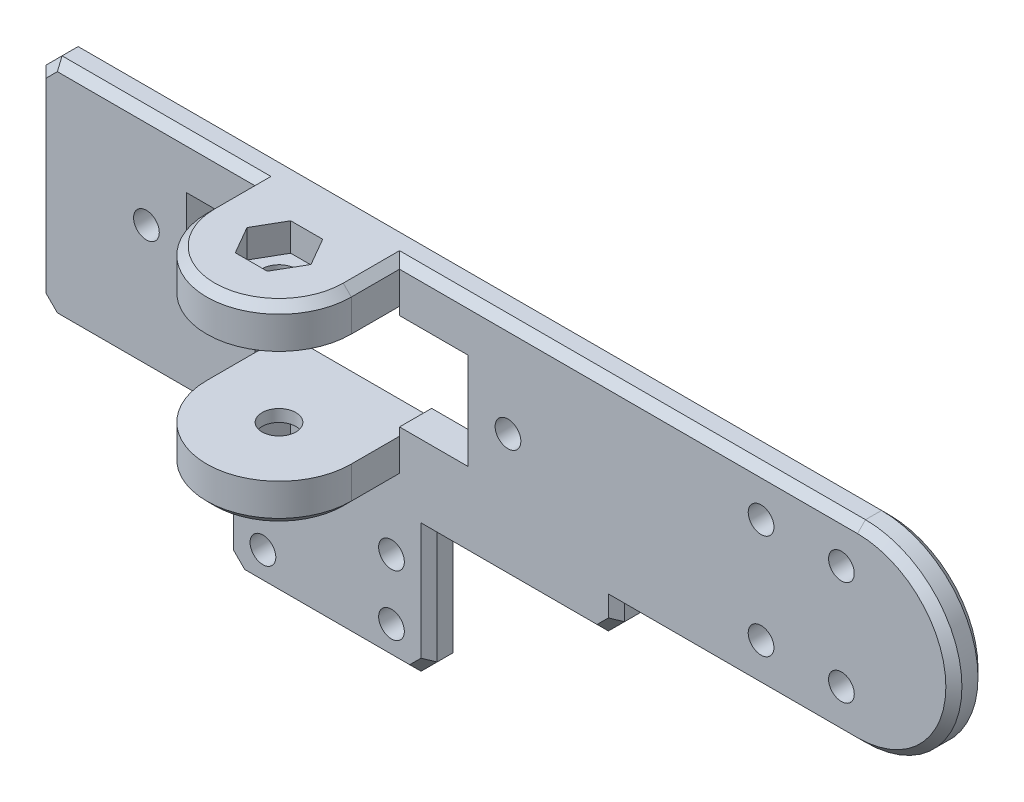
from build123d import *

# Parameters (mm, degrees)
CROQUIS1_W              = 72
CROQUIS1_H              = 24
CROQUIS1_R              = 1.6
CROQUIS1_W_2            = 35
CROQUIS1_H_2            = 12
SALIENTE_EXTRUIR1_DEPTH = 4
CROQUIS2_R              = 3.125
SALIENTE_EXTRUIR2_DEPTH = 4
CROQUIS3_R              = 1.6
SALIENTE_EXTRUIR3_DEPTH = 4
CROQUIS5_R              = 2.1
SALIENTE_EXTRUIR4_DEPTH = 5
CORTAR_EXTRUIR1_DEPTH   = 3.5
REDONDEO1_R             = 3
CROQUIS7_W              = 25.361567636
CROQUIS7_H              = 16
CROQUIS7_R              = 1.6
SALIENTE_EXTRUIR5_DEPTH = 4
CHAFL_N1_SIZE           = 2
CHAFL_N2_SIZE           = 1
CROQUIS8_W              = 18
CROQUIS8_H              = 14
CORTAR_EXTRUIR2_DEPTH   = 87.423376467
CROQUIS9_W              = 19.069204895
CROQUIS9_H              = 8.04839492
CORTAR_EXTRUIR3_DEPTH   = 120.920807202


with BuildPart() as part:
    # Croquis1 → Saliente-Extruir1 (new body)
    with BuildSketch(Plane.XY):
        Rectangle(CROQUIS1_W, CROQUIS1_H)
        with Locations((-22.5, 0)):
            Circle(CROQUIS1_R, mode=Mode.SUBTRACT)
        with Locations(Location((22.5, 0, 0), (0, 0, 180))):
            Circle(CROQUIS1_R, mode=Mode.SUBTRACT)
        Rectangle(CROQUIS1_W_2, CROQUIS1_H_2, mode=Mode.SUBTRACT)
    extrude(amount=SALIENTE_EXTRUIR1_DEPTH)

    # Croquis2 → Saliente-Extruir2 (add)
    with BuildSketch(Plane.XZ.offset(12)):
        with BuildLine():
            Line((-5, -10), (-5, -4))
            Line((-5, -4), (-36, -4))
            Line((-36, -4), (-36, 4))
            Line((-36, 4), (36, 4))
            Line((36, 4), (36, -4))
            Line((36, -4), (5, -4))
            Line((5, -4), (5, -10))
            ThreePointArc((5, -10), (0, -15), (-5, -10))
        make_face()
        with Locations((0, -10)):
            Circle(CROQUIS2_R, mode=Mode.SUBTRACT)
    extrude(amount=SALIENTE_EXTRUIR2_DEPTH)

    # Croquis3 → Saliente-Extruir3 (add)
    with BuildSketch(Plane(origin=(0, 0, 0), x_dir=(-1, 0, 0), z_dir=(0, 0, -1))):
        with BuildLine():
            Line((-66, 12), (-36, 12))
            Line((-36, 12), (-36, -12))
            Line((-36, -12), (-66, -12))
            ThreePointArc((-66, -12), (-78, 0), (-66, 12))
        make_face()
        with Locations((-54, 6.5)):
            Circle(CROQUIS3_R, mode=Mode.SUBTRACT)
        with Locations((-64, 6.5)):
            Circle(CROQUIS3_R, mode=Mode.SUBTRACT)
        with Locations(Location((-54, -6.5, 0), (0, 0, 180))):
            Circle(CROQUIS3_R, mode=Mode.SUBTRACT)
        with Locations(Location((-64, -6.5, 0), (0, 0, 180))):
            Circle(CROQUIS3_R, mode=Mode.SUBTRACT)
    extrude(amount=-SALIENTE_EXTRUIR3_DEPTH)

    # Croquis5 → Saliente-Extruir4 (add)
    with BuildSketch(Plane(origin=(0, 12, 0), x_dir=(1, 0, 0), z_dir=(0, 1, 0))):
        with BuildLine():
            Line((-9, -10), (-9, -4))
            Line((-9, -4), (9, -4))
            Line((9, -4), (9, -10))
            ThreePointArc((9, -10), (0, -19), (-9, -10))
        make_face()
        with Locations(Location((0, -10, 0), (0, 0, 180))):
            Circle(CROQUIS5_R, mode=Mode.SUBTRACT)
    saliente_extruir4 = extrude(amount=-SALIENTE_EXTRUIR4_DEPTH)

    # Croquis6 → Cortar-Extruir1 (cut)
    with BuildSketch(Plane(origin=(0, 12, 0), x_dir=(1, 0, 0), z_dir=(0, 1, 0))):
        Polygon((3.982338332, -10), (1.991169166, -6.551193838), (-1.991169166, -6.551193838), (-3.982338332, -10), (-1.991169166, -13.448806162), (1.991169166, -13.448806162), align=None)
    cortar_extruir1 = extrude(amount=-CORTAR_EXTRUIR1_DEPTH, mode=Mode.SUBTRACT)

    # Simetría1: Saliente-Extruir4, Cortar-Extruir1 across plane
    add(saliente_extruir4.mirror(Plane.ZX))
    add(cortar_extruir1.mirror(Plane.ZX), mode=Mode.SUBTRACT)

    # Redondeo1
    redondeo1_edges = [part.edges().sort_by_distance(p)[0] for p in [
        (0, -12, 0),
    ]]
    fillet(redondeo1_edges, radius=REDONDEO1_R)

    # Croquis7 → Saliente-Extruir5 (add)
    with BuildSketch(Plane.XY.offset(4)):
        with Locations((0, -24)):
            Rectangle(CROQUIS7_W, CROQUIS7_H)
        with Locations((-8, -20.25)):
            Circle(CROQUIS7_R, mode=Mode.SUBTRACT)
        with Locations(Location((8, -20.25, 0), (0, 0, 180))):
            Circle(CROQUIS7_R, mode=Mode.SUBTRACT)
        with Locations((8, -27.75)):
            Circle(CROQUIS7_R, mode=Mode.SUBTRACT)
        with Locations(Location((-8, -27.75, 0), (0, 0, 180))):
            Circle(CROQUIS7_R, mode=Mode.SUBTRACT)
    extrude(amount=-SALIENTE_EXTRUIR5_DEPTH)

    # Chaflán1
    chafl_n1_edges = [part.edges().sort_by_distance(p)[0] for p in [
        (12.680783818, -32, 2),
        (-12.680783818, -32, 2),
        (36, -16, 0),
        (-36, -16, 0),
        (-36, 12, 2),
    ]]
    chamfer(chafl_n1_edges, length=CHAFL_N1_SIZE)

    # Chaflán2
    # the kernel refuses this chamfer: 1 mm, written as the material it takes off along each edge
    with BuildSketch(Plane(origin=(0, -12, 10), x_dir=(1, 0, 0), z_dir=(0, 0, -1))) as chafl_n2_piece_1:
        Polygon((9 - CHAFL_N2_SIZE, 0), (9, -CHAFL_N2_SIZE), (9, 0), align=None)
    revolve(axis=Axis((0, -12, 10), (0, -1, 0)), revolution_arc=180, mode=Mode.SUBTRACT)
    with BuildSketch(Plane(origin=(9, -12, 4), x_dir=(-0.9996219169112968, -0.027495876610585623, 0), z_dir=(0, 0, 1)), Plane(origin=(-9, -12, 10), x_dir=(0.9996219169112968, -0.0274958766105856, 0), z_dir=(0, 0, -1))) as chafl_n2_piece_2:
        Polygon((CHAFL_N2_SIZE * 0.999621916911, -CHAFL_N2_SIZE * 0.0274958766106), (-CHAFL_N2_SIZE * 0.0274958766106, -CHAFL_N2_SIZE * 0.999621916911), (0, 0), align=None)
    extrude(amount=6, mode=Mode.SUBTRACT)
    with BuildSketch(Plane(origin=(-36.571682988, -16, 4), x_dir=(0, 0.9996219169112968, 0.02749587661058651), z_dir=(1, 0, 0)), Plane(origin=(12.680783818, -16, 4), x_dir=(0, 0.9996219169112968, 0.02749587661058651), z_dir=(1, 0, 0))) as chafl_n2_piece_3:
        Polygon((CHAFL_N2_SIZE * 0.999621916911, -CHAFL_N2_SIZE * 0.0274958766106), (-CHAFL_N2_SIZE * 0.0274958766106, -CHAFL_N2_SIZE * 0.999621916911), (0, 0), align=None)
    extrude(amount=23.89089917, mode=Mode.SUBTRACT)
    with BuildSketch(Plane(origin=(-12.680783818, -16, 0), x_dir=(-0.02749587661058563, 0, 0.9996219169112968), z_dir=(0, -1, 0)), Plane(origin=(-12.680783818, -16, 4), x_dir=(0.9996219169112968, 0, 0.02749587661058651), z_dir=(0, -1, 0)), Plane(origin=(12.680783818, -32.571682988, 4), x_dir=(-0.9996219169112968, 0, 0.02749587661058651), z_dir=(0, 1, 0)), Plane(origin=(12.680783818, -32.571682988, 0), x_dir=(0.02749587661058563, 0, 0.9996219169112968), z_dir=(0, 1, 0))) as chafl_n2_piece_4:
        Polygon((CHAFL_N2_SIZE * 0.999621916911, -CHAFL_N2_SIZE * 0.0274958766106), (-CHAFL_N2_SIZE * 0.0274958766106, -CHAFL_N2_SIZE * 0.999621916911), (0, 0), align=None)
    extrude(amount=16.571682988, mode=Mode.SUBTRACT)
    with BuildSketch(Plane(origin=(-36, 12.571682988, 4), x_dir=(0.9996219169112968, 0, 0.027495876610586414), z_dir=(0, -1, 0))) as chafl_n2_piece_5:
        Polygon((CHAFL_N2_SIZE * 0.999621916911, -CHAFL_N2_SIZE * 0.0274958766106), (-CHAFL_N2_SIZE * 0.0274958766106, -CHAFL_N2_SIZE * 0.999621916911), (0, 0), align=None)
    extrude(amount=29.143365976, mode=Mode.SUBTRACT)
    with BuildSketch(Plane(origin=(-13.252466806, -32, 4), x_dir=(0, 0.9996219169112968, 0.02749587661058651), z_dir=(1, 0, 0)), Plane(origin=(-13.252466806, -32, 0), x_dir=(0, -0.02749587661058908, 0.9996219169112968), z_dir=(1, 0, 0))) as chafl_n2_piece_6:
        Polygon((CHAFL_N2_SIZE * 0.999621916911, -CHAFL_N2_SIZE * 0.0274958766106), (-CHAFL_N2_SIZE * 0.0274958766106, -CHAFL_N2_SIZE * 0.999621916911), (0, 0), align=None)
    extrude(amount=26.504933612, mode=Mode.SUBTRACT)
    with BuildSketch(Plane(origin=(36, -12, 4), x_dir=(0.02749587661058907, 0, -0.9996219169112965), z_dir=(0, -1, 0))) as chafl_n2_piece_7:
        Polygon((CHAFL_N2_SIZE * 0.999621916911, -CHAFL_N2_SIZE * 0.0274958766106), (-CHAFL_N2_SIZE * 0.0274958766106, -CHAFL_N2_SIZE * 0.999621916911), (0, 0), align=None)
    extrude(amount=4.571682988, mode=Mode.SUBTRACT)
    with BuildSketch(Plane(origin=(14.499238298, -28.18154552, 4), x_dir=(-0.7068394360706736, 0.7068394360706736, 0.027495876610586528), z_dir=(-0.7071067811865476, -0.7071067811865476, 0)), Plane(origin=(-32.18154552, -17.81845448, 4), x_dir=(0.7068394360706736, 0.7068394360706736, 0.027495876610586563), z_dir=(-0.7071067811865476, 0.7071067811865476, 0)), Plane(origin=(-37.81845448, 8.18154552, 4), x_dir=(0.7068394360706736, -0.7068394360706736, 0.027495876610586462), z_dir=(0.7071067811865476, 0.7071067811865476, 0))) as chafl_n2_piece_8:
        Polygon((CHAFL_N2_SIZE * 0.999621916911, CHAFL_N2_SIZE * 0.0274958766106), (-CHAFL_N2_SIZE * 0.0274958766106, CHAFL_N2_SIZE * 0.999621916911), (0, 0), align=None)
    extrude(amount=7.971793101, mode=Mode.SUBTRACT)
    with BuildSketch(Plane(origin=(-14.499238298, -28.18154552, 4), x_dir=(0.7068394360706736, 0.7068394360706736, 0.027495876610586528), z_dir=(0.7071067811865476, -0.7071067811865476, 0)), Plane(origin=(37.81845448, -12.18154552, 4), x_dir=(0.019442520806013792, -0.019442520806013792, -0.9996219169112968), z_dir=(-0.7071067811865476, -0.7071067811865476, 0)), Plane(origin=(-14.499238298, -28.18154552, 0), x_dir=(-0.019442520806013792, -0.019442520806013792, 0.9996219169112968), z_dir=(0.7071067811865476, -0.7071067811865476, 0))) as chafl_n2_piece_9:
        Polygon((CHAFL_N2_SIZE * 0.999621916911, -CHAFL_N2_SIZE * 0.0274958766106), (-CHAFL_N2_SIZE * 0.0274958766106, -CHAFL_N2_SIZE * 0.999621916911), (0, 0), align=None)
    extrude(amount=7.971793101, mode=Mode.SUBTRACT)
    with BuildSketch(Plane(origin=(-36.571682988, 12, 0), x_dir=(0, -0.9996219169112968, -0.02749587661058639), z_dir=(1, 0, 0))) as chafl_n2_piece_10:
        Polygon((CHAFL_N2_SIZE * 0.999621916911, -CHAFL_N2_SIZE * 0.0274958766106), (-CHAFL_N2_SIZE * 0.0274958766106, -CHAFL_N2_SIZE * 0.999621916911), (0, 0), align=None)
    extrude(amount=102.571682988, mode=Mode.SUBTRACT)
    with BuildSketch(Plane(origin=(66, 0, 4), x_dir=(0, -1, 0), z_dir=(-1, 0, 0))) as chafl_n2_piece_11:
        Polygon((12 - CHAFL_N2_SIZE, 0), (12, -CHAFL_N2_SIZE), (12, 0), align=None)
    revolve(axis=Axis((66, 0, 4), (0, 0, 1)), revolution_arc=180, mode=Mode.SUBTRACT)
    with BuildSketch(Plane(origin=(66, 0, 0), x_dir=(0, -1, 0), z_dir=(-1, 0, 0))) as chafl_n2_piece_12:
        Polygon((12 - CHAFL_N2_SIZE, 0), (12, CHAFL_N2_SIZE), (12, 0), align=None)
    revolve(axis=Axis((66, 0, 0), (0, 0, 1)), revolution_arc=180, mode=Mode.SUBTRACT)
    with BuildSketch(Plane(origin=(36, -12, 0), x_dir=(0, -0.02749587661058563, 0.9996219169112968), z_dir=(1, 0, 0)), Plane(origin=(36, -12, 4), x_dir=(0, 0.9996219169112968, 0.02749587661058651), z_dir=(1, 0, 0))) as chafl_n2_piece_13:
        Polygon((CHAFL_N2_SIZE * 0.999621916911, -CHAFL_N2_SIZE * 0.0274958766106), (-CHAFL_N2_SIZE * 0.0274958766106, -CHAFL_N2_SIZE * 0.999621916911), (0, 0), align=None)
    extrude(amount=30, mode=Mode.SUBTRACT)
    with BuildSketch(Plane(origin=(-9, 12, 4), x_dir=(0, -0.9996219169112968, 0.02749587661058651), z_dir=(-1, 0, 0))) as chafl_n2_piece_14:
        Polygon((CHAFL_N2_SIZE * 0.999621916911, -CHAFL_N2_SIZE * 0.0274958766106), (-CHAFL_N2_SIZE * 0.0274958766106, -CHAFL_N2_SIZE * 0.999621916911), (0, 0), align=None)
    extrude(amount=27.571682988, mode=Mode.SUBTRACT)
    with BuildSketch(Plane(origin=(66, 12, 4), x_dir=(0, -0.9996219169112968, 0.02749587661058651), z_dir=(-1, 0, 0))) as chafl_n2_piece_15:
        Polygon((CHAFL_N2_SIZE * 0.999621916911, -CHAFL_N2_SIZE * 0.0274958766106), (-CHAFL_N2_SIZE * 0.0274958766106, -CHAFL_N2_SIZE * 0.999621916911), (0, 0), align=None)
    extrude(amount=57, mode=Mode.SUBTRACT)
    with BuildSketch(Plane(origin=(0, 12, 10), x_dir=(1, 0, 0), z_dir=(0, 0, -1))) as chafl_n2_piece_16:
        Polygon((9 - CHAFL_N2_SIZE, 0), (9, CHAFL_N2_SIZE), (9, 0), align=None)
    revolve(axis=Axis((0, 12, 10), (0, -1, 0)), revolution_arc=180, mode=Mode.SUBTRACT)
    with BuildSketch(Plane(origin=(9, 12, 4), x_dir=(-0.9996219169112968, 0.027495876610587396, 0), z_dir=(0, 0, 1)), Plane(origin=(-9, 12, 10), x_dir=(0.9996219169112968, 0.027495876610585623, 0), z_dir=(0, 0, -1))) as chafl_n2_piece_17:
        Polygon((CHAFL_N2_SIZE * 0.999621916911, CHAFL_N2_SIZE * 0.0274958766106), (-CHAFL_N2_SIZE * 0.0274958766106, CHAFL_N2_SIZE * 0.999621916911), (0, 0), align=None)
    extrude(amount=6, mode=Mode.SUBTRACT)
    with BuildSketch(Plane(origin=(-12.680783818, -13.428317012, 4), x_dir=(0.9996219169112968, 0, 0.02749587661058651), z_dir=(0, -1, 0))) as chafl_n2_piece_18a_section:
        Polygon((CHAFL_N2_SIZE * 0.999621916911, -CHAFL_N2_SIZE * 0.0274958766106), (-CHAFL_N2_SIZE * 0.0274958766106, -CHAFL_N2_SIZE * 0.999621916911), (0, 0), align=None)
    chafl_n2_piece_18a = extrude(amount=19.143365976, mode=Mode.PRIVATE)
    chafl_n2_piece_18a = split(chafl_n2_piece_18a, bisect_by=Plane(origin=(-12.350990191, -16, 3.670206373), z_dir=(0, 1, 0)), keep=Keep.TOP, mode=Mode.PRIVATE)
    with BuildSketch(Plane(origin=(-36.571682988, -16, 4), x_dir=(0, 0.9996219169112968, 0.02749587661058651), z_dir=(1, 0, 0))) as chafl_n2_piece_18b_section:
        Polygon((CHAFL_N2_SIZE * 0.999621916911, -CHAFL_N2_SIZE * 0.0274958766106), (-CHAFL_N2_SIZE * 0.0274958766106, -CHAFL_N2_SIZE * 0.999621916911), (0, 0), align=None)
    chafl_n2_piece_18b = extrude(amount=26.462582158, mode=Mode.PRIVATE)
    chafl_n2_piece_18b = split(chafl_n2_piece_18b, bisect_by=Plane(origin=(-12.680783818, -15.670206373, 3.670206373), z_dir=(1, 0, 0)), keep=Keep.TOP, mode=Mode.PRIVATE)
    chafl_n2_piece_18 = chafl_n2_piece_18a & chafl_n2_piece_18b
    add(chafl_n2_piece_18, mode=Mode.SUBTRACT)
    with BuildSketch(Plane(origin=(10.10910083, -16, 4), x_dir=(0, 0.9996219169112968, 0.02749587661058651), z_dir=(1, 0, 0))) as chafl_n2_piece_19a_section:
        Polygon((CHAFL_N2_SIZE * 0.999621916911, -CHAFL_N2_SIZE * 0.0274958766106), (-CHAFL_N2_SIZE * 0.0274958766106, -CHAFL_N2_SIZE * 0.999621916911), (0, 0), align=None)
    chafl_n2_piece_19a = extrude(amount=26.462582158, mode=Mode.PRIVATE)
    chafl_n2_piece_19a = split(chafl_n2_piece_19a, bisect_by=Plane(origin=(12.680783818, -15.670206373, 3.670206373), z_dir=(-1, 0, 0)), keep=Keep.TOP, mode=Mode.PRIVATE)
    with BuildSketch(Plane(origin=(12.680783818, -32.571682988, 4), x_dir=(-0.9996219169112968, 0, 0.02749587661058651), z_dir=(0, 1, 0))) as chafl_n2_piece_19b_section:
        Polygon((CHAFL_N2_SIZE * 0.999621916911, -CHAFL_N2_SIZE * 0.0274958766106), (-CHAFL_N2_SIZE * 0.0274958766106, -CHAFL_N2_SIZE * 0.999621916911), (0, 0), align=None)
    chafl_n2_piece_19b = extrude(amount=19.143365976, mode=Mode.PRIVATE)
    chafl_n2_piece_19b = split(chafl_n2_piece_19b, bisect_by=Plane(origin=(12.350990191, -16, 3.670206373), z_dir=(0, 1, 0)), keep=Keep.TOP, mode=Mode.PRIVATE)
    chafl_n2_piece_19 = chafl_n2_piece_19a & chafl_n2_piece_19b
    add(chafl_n2_piece_19, mode=Mode.SUBTRACT)
    with BuildSketch(Plane(origin=(36, -9.428317012, 4), x_dir=(0.02749587661058907, 0, -0.9996219169112965), z_dir=(0, -1, 0))) as chafl_n2_piece_20a_section:
        Polygon((CHAFL_N2_SIZE * 0.999621916911, -CHAFL_N2_SIZE * 0.0274958766106), (-CHAFL_N2_SIZE * 0.0274958766106, -CHAFL_N2_SIZE * 0.999621916911), (0, 0), align=None)
    chafl_n2_piece_20a = extrude(amount=7.143365976, mode=Mode.PRIVATE)
    chafl_n2_piece_20a = split(chafl_n2_piece_20a, bisect_by=Plane(origin=(35.670206373, -12, 3.670206373), z_dir=(0, 1, 0)), keep=Keep.TOP, mode=Mode.PRIVATE)
    with BuildSketch(Plane(origin=(33.428317012, -12, 4), x_dir=(0, 0.9996219169112968, 0.02749587661058651), z_dir=(1, 0, 0))) as chafl_n2_piece_20b_section:
        Polygon((CHAFL_N2_SIZE * 0.999621916911, -CHAFL_N2_SIZE * 0.0274958766106), (-CHAFL_N2_SIZE * 0.0274958766106, -CHAFL_N2_SIZE * 0.999621916911), (0, 0), align=None)
    chafl_n2_piece_20b = extrude(amount=32.571682988, mode=Mode.PRIVATE)
    chafl_n2_piece_20b = split(chafl_n2_piece_20b, bisect_by=Plane(origin=(36, -11.670206373, 3.670206373), z_dir=(-1, 0, 0)), keep=Keep.TOP, mode=Mode.PRIVATE)
    chafl_n2_piece_20 = chafl_n2_piece_20a & chafl_n2_piece_20b
    add(chafl_n2_piece_20, mode=Mode.SUBTRACT)
    with BuildSketch(Plane(origin=(-6.428317012, 12, 4), x_dir=(0, -0.9996219169112968, 0.02749587661058651), z_dir=(-1, 0, 0))) as chafl_n2_piece_21a_section:
        Polygon((CHAFL_N2_SIZE * 0.999621916911, -CHAFL_N2_SIZE * 0.0274958766106), (-CHAFL_N2_SIZE * 0.0274958766106, -CHAFL_N2_SIZE * 0.999621916911), (0, 0), align=None)
    chafl_n2_piece_21a = extrude(amount=30.143365976, mode=Mode.PRIVATE)
    chafl_n2_piece_21a = split(chafl_n2_piece_21a, bisect_by=Plane(origin=(-9, 11.670206373, 3.670206373), z_dir=(1, 0, 0)), keep=Keep.TOP, mode=Mode.PRIVATE)
    with BuildSketch(Plane(origin=(-9, 12, 10), x_dir=(0.9996219169112968, 0.027495876610585623, 0), z_dir=(0, 0, -1))) as chafl_n2_piece_21b_section:
        Polygon((CHAFL_N2_SIZE * 0.999621916911, CHAFL_N2_SIZE * 0.0274958766106), (-CHAFL_N2_SIZE * 0.0274958766106, CHAFL_N2_SIZE * 0.999621916911), (0, 0), align=None)
    chafl_n2_piece_21b = extrude(amount=8.571682988, mode=Mode.PRIVATE)
    chafl_n2_piece_21b = split(chafl_n2_piece_21b, bisect_by=Plane(origin=(-8.670206373, 11.670206373, 4), z_dir=(0, 0, -1)), keep=Keep.TOP, mode=Mode.PRIVATE)
    chafl_n2_piece_21 = chafl_n2_piece_21a & chafl_n2_piece_21b
    add(chafl_n2_piece_21, mode=Mode.SUBTRACT)
    with BuildSketch(Plane(origin=(66, 12, 4), x_dir=(0, -0.9996219169112968, 0.02749587661058651), z_dir=(-1, 0, 0))) as chafl_n2_piece_22a_section:
        Polygon((CHAFL_N2_SIZE * 0.999621916911, -CHAFL_N2_SIZE * 0.0274958766106), (-CHAFL_N2_SIZE * 0.0274958766106, -CHAFL_N2_SIZE * 0.999621916911), (0, 0), align=None)
    chafl_n2_piece_22a = extrude(amount=59.571682988, mode=Mode.PRIVATE)
    chafl_n2_piece_22a = split(chafl_n2_piece_22a, bisect_by=Plane(origin=(9, 11.670206373, 3.670206373), z_dir=(-1, 0, 0)), keep=Keep.TOP, mode=Mode.PRIVATE)
    with BuildSketch(Plane(origin=(9, 12, 1.428317012), x_dir=(-0.9996219169112968, 0.027495876610585623, 0), z_dir=(0, 0, 1))) as chafl_n2_piece_22b_section:
        Polygon((CHAFL_N2_SIZE * 0.999621916911, CHAFL_N2_SIZE * 0.0274958766106), (-CHAFL_N2_SIZE * 0.0274958766106, CHAFL_N2_SIZE * 0.999621916911), (0, 0), align=None)
    chafl_n2_piece_22b = extrude(amount=8.571682988, mode=Mode.PRIVATE)
    chafl_n2_piece_22b = split(chafl_n2_piece_22b, bisect_by=Plane(origin=(8.670206373, 11.670206373, 4), z_dir=(0, 0, -1)), keep=Keep.TOP, mode=Mode.PRIVATE)
    chafl_n2_piece_22 = chafl_n2_piece_22a & chafl_n2_piece_22b
    add(chafl_n2_piece_22, mode=Mode.SUBTRACT)

    # Croquis8 → Cortar-Extruir2 (cut, through all)
    with BuildSketch(Plane.XY.offset(4)):
        Rectangle(CROQUIS8_W, CROQUIS8_H)
    extrude(amount=-CORTAR_EXTRUIR2_DEPTH, mode=Mode.SUBTRACT)

    # Croquis9 → Cortar-Extruir3 (cut, through all)
    with BuildSketch(Plane.ZY.offset(36)):
        with Locations((-9.534602448, -11.97580254)):
            Rectangle(CROQUIS9_W, CROQUIS9_H)
    extrude(amount=-CORTAR_EXTRUIR3_DEPTH, mode=Mode.SUBTRACT)


solid = part.part
